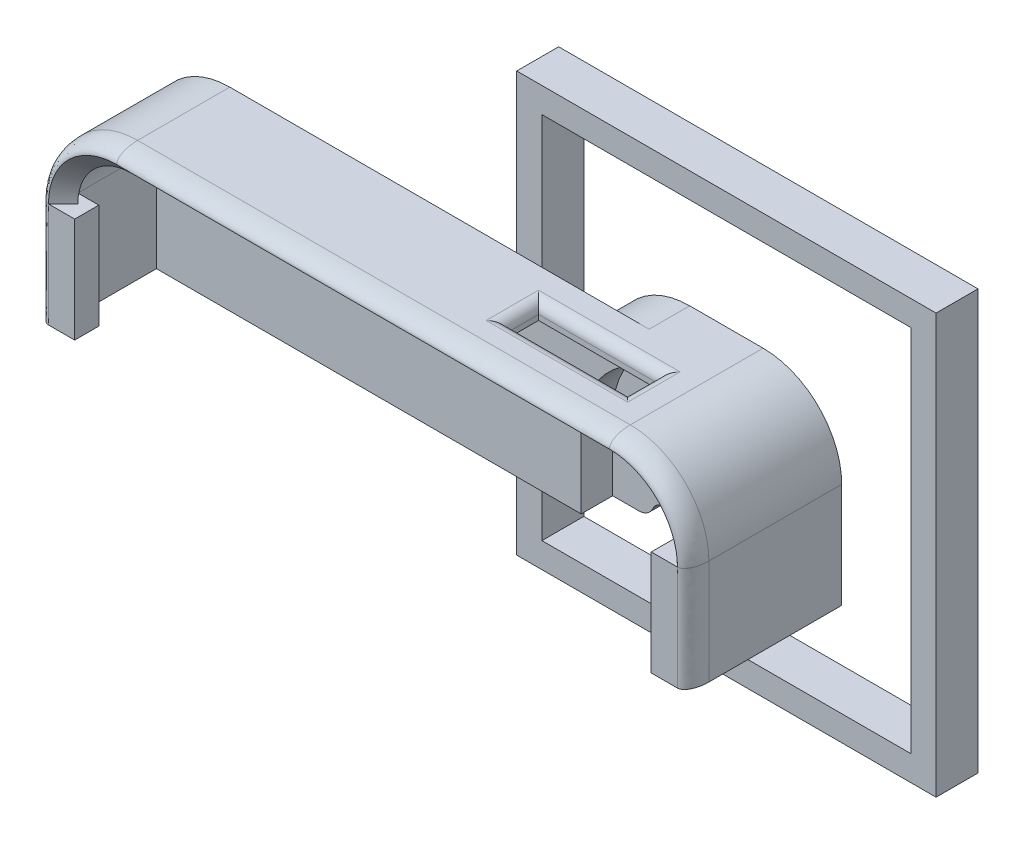
from build123d import *

# Parameters (mm, degrees)
BOSS_EXTRUDE1_DEPTH = 10.8
BOSS_EXTRUDE2_DEPTH = 1
SKETCH3_W           = 2
SKETCH3_H           = 10
BOSS_EXTRUDE3_DEPTH = 2.3
FILLET1_SIZE        = 2
FILLET1_SIZE_2      = 1
CUT_EXTRUDE1_REACH  = 67.321
SKETCH4_W           = 11.5
SKETCH4_H           = 3
BOSS_EXTRUDE4_DEPTH = 2.3
CHAMFER1_SIZE       = 1.5
CUT_EXTRUDE2_DEPTH  = 2
BOSS_EXTRUDE6_DEPTH = 2
FILLET2_R           = 1
BOSS_EXTRUDE7_DEPTH = 1.87
SKETCH11_R          = 2.5
CUT_EXTRUDE3_DEPTH  = 66.681732761
SKETCH19_W          = 10
SKETCH19_H          = 1.87
CUT_EXTRUDE5_DEPTH  = 1.5
FILLET7_R           = 1.5
FILLET8_R           = 1
SKETCH20_W          = 40
SKETCH20_H          = 40
SKETCH20_W_2        = 35.2
SKETCH20_H_2        = 35.2
BOSS_EXTRUDE8_DEPTH = 4


with BuildPart() as part:
    # Sketch1 → Boss-Extrude1 (new body)
    with BuildSketch(Plane.XY):
        with BuildLine():
            Line((31, 16), (31, 17.5))
            Line((31, 17.5), (7.5, 17.5))
            ThreePointArc((7.5, 17.5), (2.196699141, 15.303300859), (0, 10))
            Line((0, 10), (0, 0))
            Line((0, 0), (1.5, 0))
            Line((1.5, 0), (1.5, 10))
            ThreePointArc((1.5, 10), (3.257359313, 14.242640687), (7.5, 16))
            Line((7.5, 16), (31, 16))
        make_face()
        with BuildLine():
            Line((54.5, 17.5), (31, 17.5))
            Line((31, 17.5), (31, 16))
            Line((31, 16), (54.5, 16))
            ThreePointArc((54.5, 16), (58.742640687, 14.242640687), (60.5, 10))
            Line((60.5, 10), (60.5, 0))
            Line((60.5, 0), (62, 0))
            Line((62, 0), (62, 10))
            ThreePointArc((62, 10), (59.803300859, 15.303300859), (54.5, 17.5))
        make_face()
    extrude(amount=BOSS_EXTRUDE1_DEPTH)


with BuildPart() as body_2:
    # Sketch2 → Boss-Extrude2 (new body)
    with BuildSketch(Plane(origin=(0, 0, 0), x_dir=(-1, 0, 0), z_dir=(0, 0, -1))):
        with BuildLine():
            Line((-1.5, 0), (-1.5, 10))
            ThreePointArc((-1.5, 10), (-3.257359313, 14.242640687), (-7.5, 16))
            Line((-7.5, 16), (-54.5, 16))
            ThreePointArc((-54.5, 16), (-58.742640687, 14.242640687), (-60.5, 10))
            Line((-60.5, 10), (-60.5, 0))
            Line((-60.5, 0), (-1.5, 0))
        make_face()
    extrude(amount=-BOSS_EXTRUDE2_DEPTH)

    # Combine1: union part
    add(part.part)

    # Sketch3 → Boss-Extrude3 (add)
    with BuildSketch(Plane.XY.offset(10.8)):
        with Locations((2.5, 5)):
            Rectangle(SKETCH3_W, SKETCH3_H)
        with Locations((59.5, 5)):
            Rectangle(SKETCH3_W, SKETCH3_H)
    extrude(amount=-BOSS_EXTRUDE3_DEPTH)

    # Fillet1
    # a fillet whose section is not a circle: 2, 1 mm, written as the material it takes off along each edge
    with BuildSketch(Plane(origin=(0, 10, 10.8), x_dir=(0, 0, -1), z_dir=(0, -1, 0))) as fillet1_piece_1:
        with BuildLine():
            Bezier((FILLET1_SIZE, 0), (0, 0), (0, FILLET1_SIZE_2), weights=[1, 0.707106781, 1])
            Line((0, FILLET1_SIZE_2), (0, 0))
            Line((0, 0), (FILLET1_SIZE, 0))
        make_face()
    extrude(amount=15, mode=Mode.SUBTRACT)
    with BuildSketch(Plane(origin=(62, -5, 10.8), x_dir=(-1, 0, 0), z_dir=(0, 1, 0))) as fillet1_piece_2:
        with BuildLine():
            Bezier((FILLET1_SIZE_2, 0), (0, 0), (0, -FILLET1_SIZE), weights=[1, 0.707106781, 1])
            Line((0, -FILLET1_SIZE), (0, 0))
            Line((0, 0), (FILLET1_SIZE_2, 0))
        make_face()
    extrude(amount=15, mode=Mode.SUBTRACT)
    with BuildSketch(Plane(origin=(7.5, 10, 10.8), x_dir=(0, 1, 0), z_dir=(1, 0, 0))) as fillet1_piece_3:
        with BuildLine():
            Bezier((7.5, -FILLET1_SIZE), (7.5, 0), (7.5 - FILLET1_SIZE_2, 0), weights=[1, 0.707106781, 1])
            Line((7.5 - FILLET1_SIZE_2, 0), (7.5, 0))
            Line((7.5, 0), (7.5, -FILLET1_SIZE))
        make_face()
    revolve(axis=Axis((7.5, 10, 10.8), (0, 0, 1)), revolution_arc=90, mode=Mode.SUBTRACT)
    with BuildSketch(Plane(origin=(54.5, 10, 10.8), x_dir=(1, 0, 0), z_dir=(0, -1, 0))) as fillet1_piece_4:
        with BuildLine():
            Bezier((7.5, -FILLET1_SIZE), (7.5, 0), (7.5 - FILLET1_SIZE_2, 0), weights=[1, 0.707106781, 1])
            Line((7.5 - FILLET1_SIZE_2, 0), (7.5, 0))
            Line((7.5, 0), (7.5, -FILLET1_SIZE))
        make_face()
    revolve(axis=Axis((54.5, 10, 10.8), (0, 0, 1)), revolution_arc=90, mode=Mode.SUBTRACT)
    with BuildSketch(Plane(origin=(7.5, 17.5, 10.8), x_dir=(0, 0, -1), z_dir=(1, 0, 0))) as fillet1_piece_5:
        with BuildLine():
            Bezier((FILLET1_SIZE, 0), (0, 0), (0, -FILLET1_SIZE_2), weights=[1, 0.707106781, 1])
            Line((0, -FILLET1_SIZE_2), (0, 0))
            Line((0, 0), (FILLET1_SIZE, 0))
        make_face()
    extrude(amount=47, mode=Mode.SUBTRACT)

    # Sketch4 → Cut-Extrude1 (cut, up to next)
    with BuildSketch(Plane(origin=(0, 17.5, 0), x_dir=(1, 0, 0), z_dir=(0, 1, 0)), mode=Mode.PRIVATE) as cut_extrude1_sk1:
        with Locations((45.75, -4.55)):
            Rectangle(SKETCH4_W, SKETCH4_H)
    cut_extrude1_tool1 = extrude(cut_extrude1_sk1.sketch, amount=-CUT_EXTRUDE1_REACH, mode=Mode.PRIVATE) & body_2.part
    add(cut_extrude1_tool1.solids().sort_by_distance((45.75, 17.5, 4.55))[0], mode=Mode.SUBTRACT)

    # Sketch5 → Boss-Extrude4 (add)
    with BuildSketch(Plane.XY.offset(10.8)):
        with BuildLine():
            Line((7.5, 15), (54.5, 15))
            ThreePointArc((54.5, 15), (58.035533906, 13.535533906), (59.5, 10))
            Line((59.5, 10), (60.5, 10))
            ThreePointArc((60.5, 10), (58.742640687, 14.242640687), (54.5, 16))
            Line((54.5, 16), (7.5, 16))
            ThreePointArc((7.5, 16), (3.257359313, 14.242640687), (1.5, 10))
            Line((1.5, 10), (2.5, 10))
            ThreePointArc((2.5, 10), (3.964466094, 13.535533906), (7.5, 15))
        make_face()
    extrude(amount=-BOSS_EXTRUDE4_DEPTH)

    # Chamfer1
    chamfer1_edges = [body_2.edges().sort_by_distance(p)[0] for p in [
        (3.964466094, 13.535533906, 10.8),
        (31, 15, 10.8),
        (58.035533906, 13.535533906, 10.8),
    ]]
    chamfer(chamfer1_edges, length=CHAMFER1_SIZE - 0.0001)  # a hair under: the kernel refuses the full size

    # Chamfer3: read off the stored shape, not the designer's step
    # Chamfer3: loft between two sections, ruled curve by curve
    chamfer3_from = [
        Edge.make_three_point_arc((2.4, 10, 9.4), (3.893755416, 13.606244584, 9.4), (7.5, 15.1, 9.4)),
        Edge.make_three_point_arc((54.5, 15.1, 9.4), (58.106244584, 13.606244584, 9.4), (59.6, 10, 9.4)),
        Edge.make_line((7.5, 15.1, 9.4), (54.5, 15.1, 9.4)),
        Edge.make_line((59.6, 10, 9.4), (2.4, 10, 9.4)),
    ]
    chamfer3_to = [
        Edge.make_three_point_arc((1.5, 10, 8.5), (3.257359313, 14.242640687, 8.5), (7.5, 16, 8.5)),
        Edge.make_three_point_arc((54.5, 16, 8.5), (58.742640687, 14.242640687, 8.5), (60.5, 10, 8.5)),
        Edge.make_line((7.5, 16, 8.5), (54.5, 16, 8.5)),
        Edge.make_line((60.5, 10, 8.5), (1.5, 10, 8.5)),
    ]
    chamfer3 = Solid(Shell([*[Face.make_surface_from_curves(chamfer3_from[k], chamfer3_to[k]) for k in range(4)], Face(Wire(chamfer3_from)), Face(Wire(chamfer3_to))]))
    add(chamfer3, mode=Mode.SUBTRACT)

    # Sketch6 → Cut-Extrude2 (cut)
    with BuildSketch(Plane(origin=(0, 0, 0), x_dir=(-1, 0, 0), z_dir=(0, 0, -1))):
        with BuildLine():
            Line((-59.98, 0), (-59.98, 6.7))
            ThreePointArc((-59.98, 6.7), (-51, 15.68), (-42.02, 6.7))
            Line((-42.02, 6.7), (-42.02, 0))
            Line((-42.02, 0), (-59.98, 0))
        make_face()
    extrude(amount=-CUT_EXTRUDE2_DEPTH, mode=Mode.SUBTRACT)

    # Sketch9 → Boss-Extrude6 (add)
    with BuildSketch(Plane(origin=(0, 0, 0), x_dir=(-1, 0, 0), z_dir=(0, 0, -1))):
        with BuildLine():
            Line((-62, 10), (-62, 0))
            Line((-62, 0), (-59.98, 0))
            Line((-59.98, 0), (-59.98, 6.7))
            ThreePointArc((-59.98, 6.7), (-51, 15.68), (-42.02, 6.7))
            Line((-42.02, 6.7), (-42.02, 0))
            Line((-42.02, 0), (-40, 0))
            Line((-40, 0), (-40, 10))
            ThreePointArc((-40, 10), (-42.196699141, 15.303300859), (-47.5, 17.5))
            Line((-47.5, 17.5), (-54.5, 17.5))
            ThreePointArc((-54.5, 17.5), (-59.803300859, 15.303300859), (-62, 10))
        make_face()
    extrude(amount=BOSS_EXTRUDE6_DEPTH)

    # Fillet2
    fillet2_edges = [body_2.edges().sort_by_distance(p)[0] for p in [
        (51.5, 17.5, 4.55),
        (45.75, 17.5, 3.05),
        (40, 17.5, 4.55),
        (45.75, 17.5, 6.05),
    ]]
    fillet(fillet2_edges, radius=FILLET2_R)

    # Sketch10 → Boss-Extrude7 (add)
    with BuildSketch(Plane(origin=(0, 0, -2), x_dir=(-1, 0, 0), z_dir=(0, 0, -1))):
        with BuildLine():
            Line((-62, 10), (-62, 0))
            Line((-62, 0), (-40, 0))
            Line((-40, 0), (-40, 10))
            ThreePointArc((-40, 10), (-42.196699141, 15.303300859), (-47.5, 17.5))
            Line((-47.5, 17.5), (-54.5, 17.5))
            ThreePointArc((-54.5, 17.5), (-59.803300859, 15.303300859), (-62, 10))
        make_face()
    extrude(amount=BOSS_EXTRUDE7_DEPTH)

    # Sketch11 → Cut-Extrude3 (cut, through all)
    with BuildSketch(Plane.XY.offset(-2)):
        with Locations((51, 8.65)):
            Circle(SKETCH11_R)
    extrude(amount=-CUT_EXTRUDE3_DEPTH, mode=Mode.SUBTRACT)

    # Sketch19 → Cut-Extrude5 (cut)
    with BuildSketch(Plane.XZ):
        with Locations((51, -2.935)):
            Rectangle(SKETCH19_W, SKETCH19_H)
    extrude(amount=-CUT_EXTRUDE5_DEPTH, mode=Mode.SUBTRACT)

    # Fillet7
    fillet7_edges = [body_2.edges().sort_by_distance(p)[0] for p in [
        (46, 0, -2.935),
        (56, 0, -2.935),
    ]]
    fillet(fillet7_edges, radius=FILLET7_R - 0.0001)  # a hair under: the kernel refuses the full size

    # Fillet8
    fillet8_edges = [body_2.edges().sort_by_distance(p)[0] for p in [
        (56, 1.5, -2.935),
        (46, 1.5, -2.935),
    ]]
    fillet(fillet8_edges, radius=FILLET8_R)


with BuildPart() as body_2_2:
    # Sketch20 → Boss-Extrude8 (new body)
    with BuildSketch(Plane(origin=(0, 0, -3.87), x_dir=(-1, 0, 0), z_dir=(0, 0, -1))):
        with Locations((-51, 8.65)):
            Rectangle(SKETCH20_W, SKETCH20_H)
        with Locations((-51, 8.65)):
            Rectangle(SKETCH20_W_2, SKETCH20_H_2, mode=Mode.SUBTRACT)
    extrude(amount=BOSS_EXTRUDE8_DEPTH)


solid = Compound([body_2.part, body_2_2.part])
